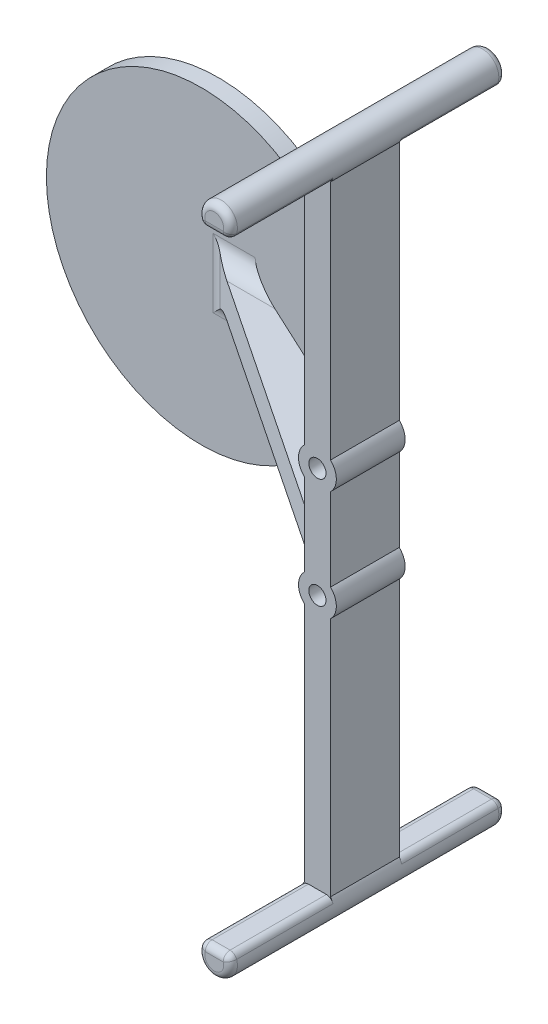
from build123d import *

# Parameters (mm, degrees)
SKETCH1_R                = 2.5000000000000036
BOSS_EXTRUDE1_DEPTH      = 20
BOSS_EXTRUDE3_START      = -30
BOSS_EXTRUDE3_DEPTH      = 30
FILLET1_R                = 2
FILLET1_OF_MIRROR2_R     = 2
BOSS_EXTRUDE5_DEPTH      = 5
BOSS_EXTRUDE5_DEPTH_BACK = 5
SKETCH10_W               = 5
SKETCH10_H               = 4.9999999999999964
SKETCH11_R               = 44.99999999999999
BOSS_EXTRUDE6_DEPTH      = 5
FILLET2_R                = 5


# Read off the part's stored shape, not the designer's step: Mirror3
with BuildPart() as part:
    # Sketch1 → Boss-Extrude1 (new body)
    with BuildSketch(Plane.XY):
        with BuildLine():
            Line((-3.7999999999999994, 5.999999999999999), (-3.799999999999992, -64.0238209295858))
            ThreePointArc((-3.800000000000015, -64.0238209295858), (-5.499999999999996, -67.99999999999999), (-3.8000000000000083, -71.97617907041419))
            Line((-3.799999999999991, -71.97617907041419), (-3.7999999999999896, -83.99999999999999))
            Line((-3.799999999999989, -83.99999999999999), (3.800000000000014, -83.99999999999999))
            Line((3.800000000000014, -83.99999999999999), (3.8000000000000123, -71.97617907041419))
            ThreePointArc((3.8000000000000083, -71.97617907041419), (5.499999999999996, -67.99999999999999), (3.800000000000015, -64.0238209295858))
            Line((3.800000000000011, -64.0238209295858), (3.7999999999999994, 6))
            ThreePointArc((3.800000000000001, 5.999999999999998), (0, 13.569343394379079), (-3.8000000000000016, 5.999999999999998))
        make_face()
        with Locations((0, -67.99999999999999)):
            Circle(SKETCH1_R, mode=Mode.SUBTRACT)
    extrude(amount=BOSS_EXTRUDE1_DEPTH)

    # Sketch5 → Boss-Extrude3 (add)
    with BuildSketch(Plane.XY.offset(BOSS_EXTRUDE3_START)):
        with BuildLine():
            ThreePointArc((4.738519293185978, 8.8308241011931), (-1.4911726556286193, 13.328597906421773), (-3.800000000000001, 5.999999999999998))
            Line((-3.8000000000000007, 5.999999999999998), (3.8000000000000007, 5.999999999999998))
            ThreePointArc((3.800000000000001, 5.999999999999999), (4.497773805228675, 7.339651445564482), (4.738519293185978, 8.830824101193098))
        make_face()
    boss_extrude3 = extrude(amount=BOSS_EXTRUDE3_DEPTH)

    # Fillet1
    fillet1_edges = [part.edges().sort_by_distance(p)[0] for p in [
        (0, 5.999999999999998, -30),
        (3.800000000000001, 5.999999999999998, -15),
        (4.44e-15, 13.569343394379077, -30),
        (-3.8000000000000016, 5.999999999999998, -15),
    ]]
    fillet(fillet1_edges, radius=FILLET1_R)

    # Mirror2: Boss-Extrude3 across plane
    add(boss_extrude3.mirror(Plane(origin=(0, 0, 10), x_dir=(1, 0, 0), z_dir=(0, 0, -1))))

    # Fillet1 of Mirror2
    fillet1_of_mirror2_edges = [part.edges().sort_by_distance(p)[0] for p in [
        (0, 5.999999999999998, 50),
        (3.800000000000001, 5.999999999999998, 35),
        (4.44e-15, 13.569343394379077, 50),
        (-3.8000000000000016, 5.999999999999998, 35),
    ]]
    fillet(fillet1_of_mirror2_edges, radius=FILLET1_OF_MIRROR2_R)

    # Mirror3: part across plane


with BuildPart() as part_1:
    add(part.part)
    add(part.part.mirror(Plane(origin=(0, -83.99999999999999, 20), x_dir=(0, 0, 1), z_dir=(0, -1, 0))))

    # Sketch10 → Boss-Extrude5 (add, two sides: drawn at the far end of the back side and taken through both)
    with BuildSketch(Plane(origin=(0, -83.99999999999999, 0), x_dir=(-1, 0, 0), z_dir=(0, -1, 0)).offset(-BOSS_EXTRUDE5_DEPTH_BACK)):
        Polygon((3.799999999999991, -20), (3.8000000000000007, 0), (78.79999999999998, 35.00000000000001), (78.79999999999998, 30.00000000000001), align=None)
        with Locations((81.29999999999998, 32.50000000000001)):
            Rectangle(SKETCH10_W, SKETCH10_H)
    extrude(amount=BOSS_EXTRUDE5_DEPTH + BOSS_EXTRUDE5_DEPTH_BACK)

    # Sketch11 → Boss-Extrude6 (add)
    with BuildSketch(Plane(origin=(0, 0, -35.00000000000001), x_dir=(-1, 0, 0), z_dir=(0, 0, -1))):
        with Locations((83.79999999999998, -83.99999999999999)):
            Circle(SKETCH11_R)
    extrude(amount=-BOSS_EXTRUDE6_DEPTH)

    # Fillet2
    fillet2_edges = [part_1.edges().sort_by_distance(p)[0] for p in [
        (-78.79999999999998, -83.99999999999999, -30.00000000000001),
        (-73.44285714285712, -88.99999999999999, -30.000000000000007),
        (-73.44285714285712, -78.99999999999999, -30.000000000000007),
    ]]
    fillet(fillet2_edges, radius=FILLET2_R)


solid = part_1.part
